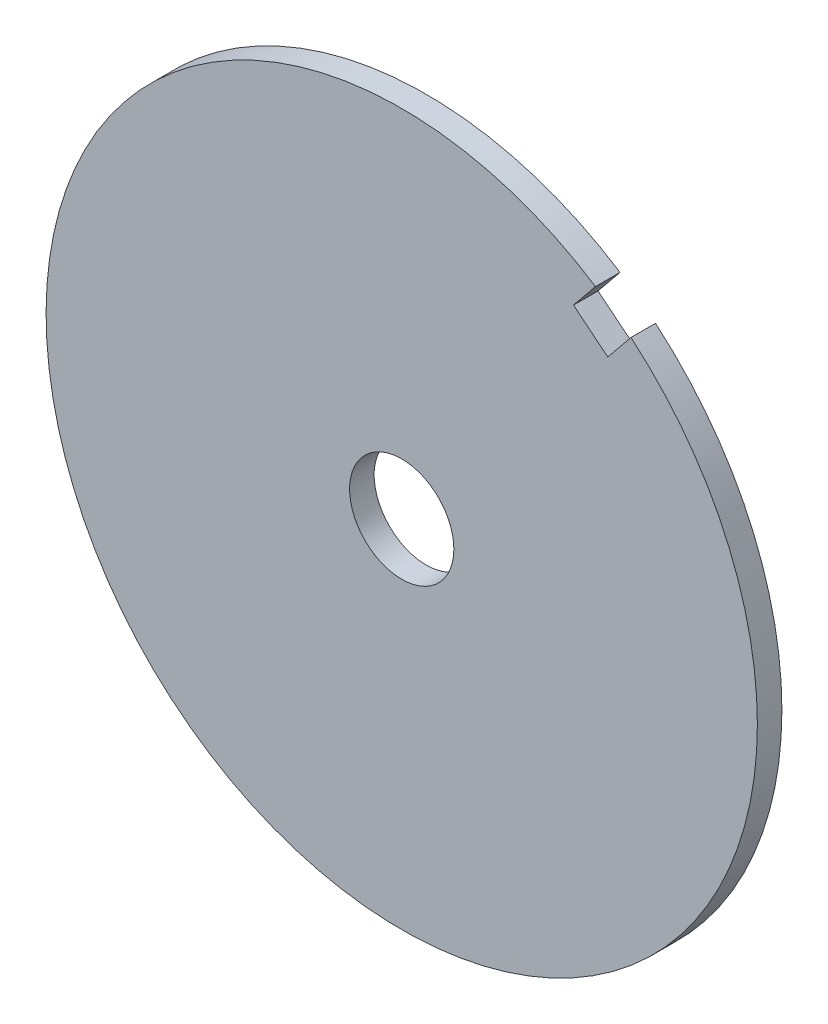
from build123d import *

# Parameters (mm, degrees)
SKETCH1_R               = 92.075
BOSS_EXTRUDE1_DEPTH     = 6.35
CUT_EXTRUDE1_REACH      = 132.368
SKETCH2_R               = 13.49375
CUT_EXTRUDE2_DEPTH      = 131.368453815
CUT_EXTRUDE2_DEPTH_BACK = 131.368453815


with BuildPart() as part:
    # Sketch1 → Boss-Extrude1 (new body)
    with BuildSketch(Plane.XY.offset(3372.777793208)):
        Circle(SKETCH1_R)
    extrude(amount=BOSS_EXTRUDE1_DEPTH)

    # Sketch2 → Cut-Extrude1 (cut, up to next)
    with BuildSketch(Plane.XY.offset(3379.127793208), mode=Mode.PRIVATE) as cut_extrude1_sk1:
        Circle(SKETCH2_R)
    cut_extrude1_tool1 = extrude(cut_extrude1_sk1.sketch, amount=-CUT_EXTRUDE1_REACH, mode=Mode.PRIVATE) & part.part
    add(cut_extrude1_tool1.solids().sort_by_distance((0, 0, 3379.127793))[0], mode=Mode.SUBTRACT)

    # Sketch3 → Cut-Extrude2 (cut, two sides: drawn at the far end of the back side and taken through both)
    with BuildSketch(Plane.XY.offset(3379.127793208).offset(-CUT_EXTRUDE2_DEPTH_BACK)):
        Polygon((336.778056762, 429.544812077), (50.163803387, 77.210092959), (44.474723828, 70.216511081), (53.341489497, 63.003649889), (59.352207157, 70.39262128), (345.966460532, 422.727340397), (887.234252195, 1152.233417028), (878.045848425, 1159.050888707), align=None)
    extrude(amount=CUT_EXTRUDE2_DEPTH + CUT_EXTRUDE2_DEPTH_BACK, mode=Mode.SUBTRACT)


solid = part.part
